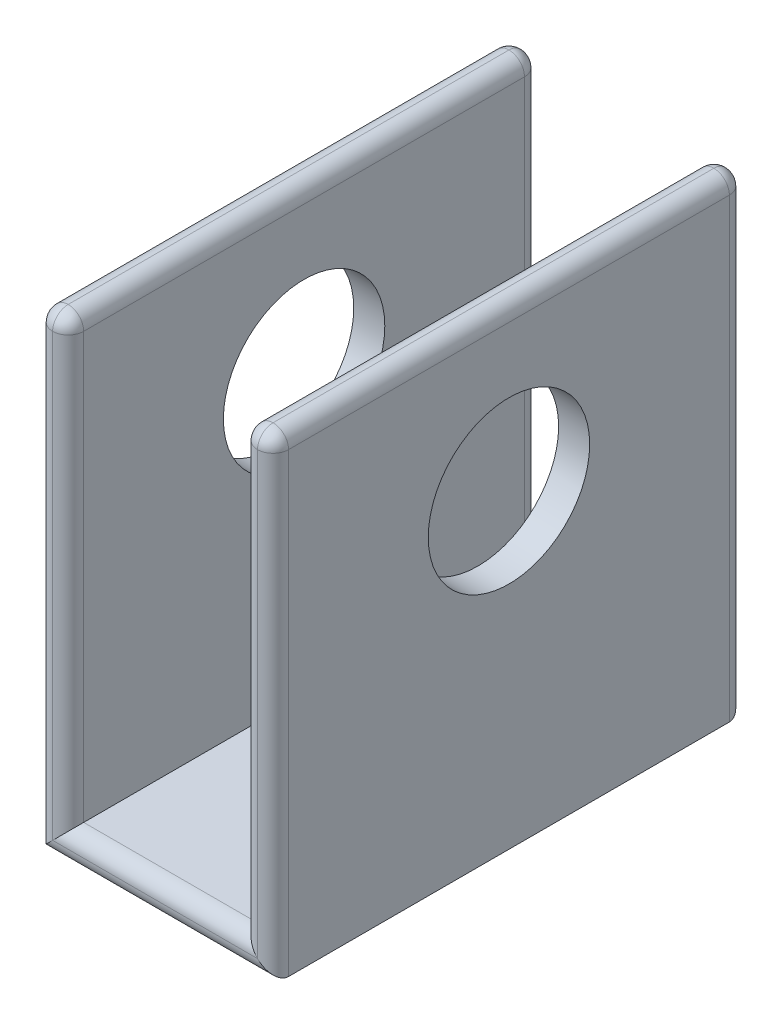
from build123d import *

# Parameters (mm, degrees)
BOSS_EXTRUDE1_DEPTH = 38
SKETCH2_R           = 6.5
CUT_EXTRUDE1_DEPTH  = 58
FILLET1_R           = 1.25


with BuildPart() as part:
    # Sketch1 → Boss-Extrude1 (new body)
    with BuildSketch(Plane.XY):
        with BuildLine():
            Line((-9.5, 0), (9.5, 0))
            Line((9.5, 0), (9.5, 38))
            Line((9.5, 38), (8.25, 38))
            ThreePointArc((8.25, 38), (7.366116524, 37.633883476), (7, 36.75))
            Line((7, 36.75), (7, 2.5))
            Line((7, 2.5), (-7, 2.5))
            Line((-7, 2.5), (-7, 36.75))
            ThreePointArc((-7, 36.75), (-7.366116524, 37.633883476), (-8.25, 38))
            Line((-8.25, 38), (-9.5, 38))
            Line((-9.5, 38), (-9.5, 0))
        make_face()
    extrude(amount=BOSS_EXTRUDE1_DEPTH)

    # Sketch2 → Cut-Extrude1 (cut, through all)
    with BuildSketch(Plane(origin=(9.5, 0, 0), x_dir=(0, 0, -1), z_dir=(1, 0, 0))):
        with Locations((-19, 25)):
            Circle(SKETCH2_R)
    extrude(amount=-CUT_EXTRUDE1_DEPTH, mode=Mode.SUBTRACT)

    # Fillet1
    fillet1_edges = [part.edges().sort_by_distance(p)[0] for p in [
        (7.366116524, 37.633883476, 0),
        (-7.366116524, 37.633883476, 0),
        (9.5, 19, 38),
        (0, 0, 38),
        (-9.5, 19, 38),
        (-7.366116524, 37.633883476, 38),
        (-7, 19.625, 38),
        (0, 2.5, 38),
        (7, 19.625, 38),
        (7.366116524, 37.633883476, 38),
        (7, 19.625, 0),
        (9.5, 19, 0),
        (0, 0, 0),
        (0, 2.5, 0),
        (-7, 19.625, 0),
        (-9.5, 19, 0),
        (-9.5, 38, 19),
        (9.5, 38, 19),
    ]]
    fillet(fillet1_edges, radius=FILLET1_R - 0.0001)  # a hair under: the kernel refuses the full size


solid = part.part
